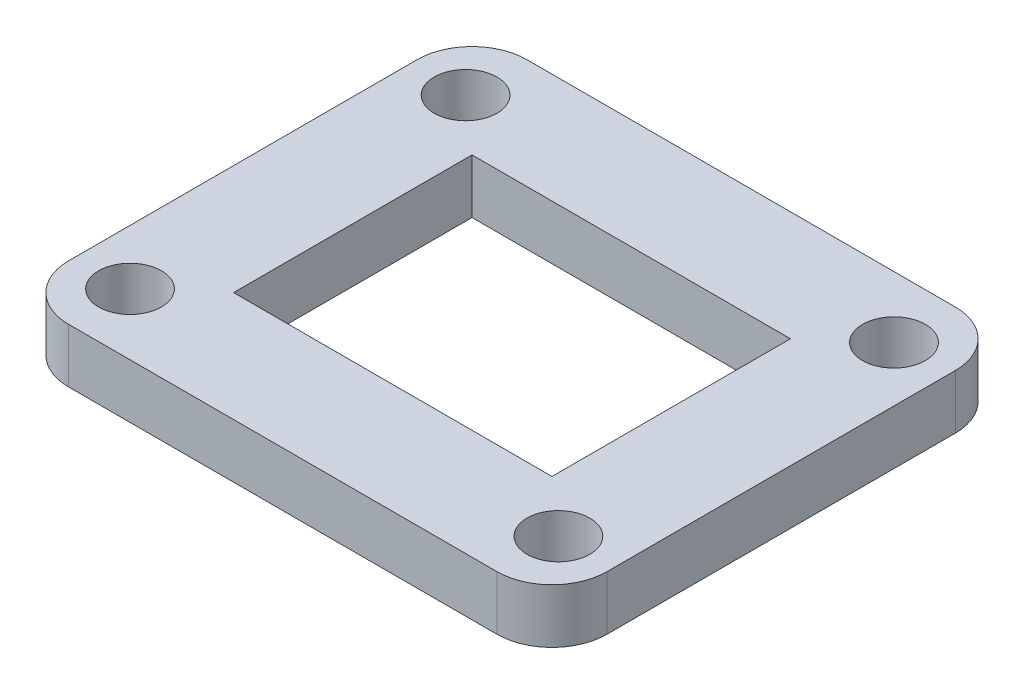
from build123d import *

# Parameters (mm, degrees)
SKETCH1_R           = 2.2
SKETCH1_W           = 22.3
SKETCH1_H           = 16.7
BOSS_EXTRUDE1_DEPTH = 3.8


with BuildPart() as part:
    # Sketch1 → Boss-Extrude1 (new body)
    with BuildSketch(Plane(origin=(0, 0, 0), x_dir=(1, 0, 0), z_dir=(0, 1, 0))):
        with BuildLine():
            Line((-15, -16.05), (15, -16.05))
            ThreePointArc((15, -16.05), (17.722361108, -14.922361108), (18.85, -12.2))
            Line((18.85, -12.2), (18.85, 12.2))
            ThreePointArc((18.85, 12.2), (17.722361108, 14.922361108), (15, 16.05))
            Line((15, 16.05), (-15, 16.05))
            ThreePointArc((-15, 16.05), (-17.722361108, 14.922361108), (-18.85, 12.2))
            Line((-18.85, 12.2), (-18.85, -12.2))
            ThreePointArc((-18.85, -12.2), (-17.722361108, -14.922361108), (-15, -16.05))
        make_face()
        with Locations((-15, 11.75)):
            Circle(SKETCH1_R, mode=Mode.SUBTRACT)
        with Locations((15, 11.75)):
            Circle(SKETCH1_R, mode=Mode.SUBTRACT)
        with Locations((-15, -11.75)):
            Circle(SKETCH1_R, mode=Mode.SUBTRACT)
        with Locations((15, -11.75)):
            Circle(SKETCH1_R, mode=Mode.SUBTRACT)
        Rectangle(SKETCH1_W, SKETCH1_H, mode=Mode.SUBTRACT)
    extrude(amount=BOSS_EXTRUDE1_DEPTH)


solid = part.part
